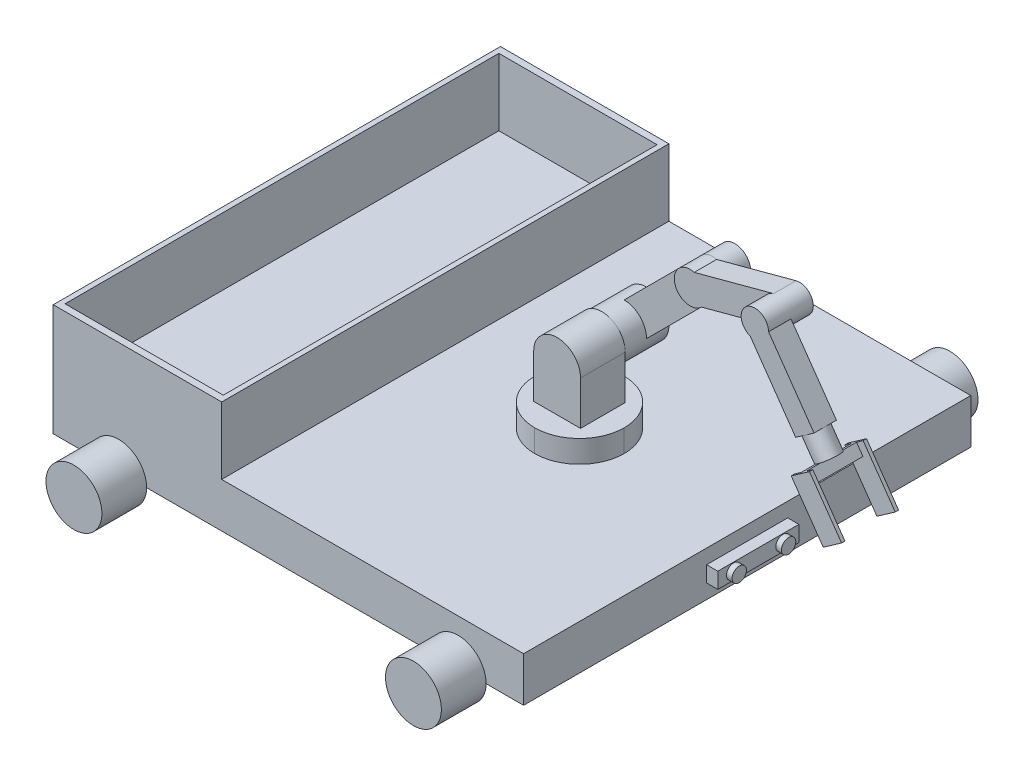
from build123d import *

# Parameters (mm, degrees)
SKETCH1_W                 = 60
SKETCH1_H                 = 4
BOSS_EXTRUDE1_DEPTH       = 40
SKETCH2_R                 = 2.5
BOSS_EXTRUDE2_DEPTH       = 4
BOSS_EXTRUDE3_START       = -44
SKETCH3_R                 = 2.5
BOSS_EXTRUDE3_DEPTH       = 4
BOSS_EXTRUDE4_DEPTH       = 4
BOSS_EXTRUDE4_DEPTH_BACK  = 4
BOSS_EXTRUDE4_START       = -20
FILLET1_R                 = 4
SKETCH5_W                 = 4.188069512
SKETCH5_H                 = 4
BOSS_EXTRUDE5_DEPTH       = 6
FILLET2_RADIUS            = 2.094034756
FILLET2_LENGTH            = 4
SKETCH6_R                 = 2
BOSS_EXTRUDE6_DEPTH       = 2
BOSS_EXTRUDE7_DEPTH       = 2
FILLET3_R                 = 1.415614
BOSS_EXTRUDE8_DEPTH       = 2
FILLET5_RADIUS            = 1.225957443
FILLET5_LENGTH            = 2
BOSS_EXTRUDE9_DEPTH       = 2
SKETCH10_R                = 1
BOSS_EXTRUDE10_DEPTH      = 2
SKETCH11_W                = 0.54512003
SKETCH11_H                = 4.5
BOSS_EXTRUDE11_DEPTH      = 1
BOSS_EXTRUDE12_DEPTH      = 4
BOSS_EXTRUDE12_DEPTH_BACK = 1
SKETCH12_W                = 2
SKETCH12_H                = 0.3
CUT_EXTRUDE1_DEPTH        = 14
CUT_EXTRUDE1_DEPTH_BACK   = 49
SKETCH15_R                = 2.5
BOSS_EXTRUDE13_DEPTH      = 4
BOSS_EXTRUDE14_START      = 4
SKETCH16_R                = 2.5
BOSS_EXTRUDE14_DEPTH      = 4
SKETCH17_W                = 15.06704388
SKETCH17_H                = 40
SKETCH17_W_2              = 14.155070378
SKETCH17_H_2              = 38.805630358
BOSS_EXTRUDE15_DEPTH      = 6
SKETCH18_W                = 7.25313331
SKETCH18_H                = 1.413138482
BOSS_EXTRUDE16_DEPTH      = 1
SKETCH19_R                = 0.644072862
BOSS_EXTRUDE17_DEPTH      = 0.5
BOSS_EXTRUDE18_DEPTH      = 0.5


with BuildPart() as part:
    # Sketch1 → Boss-Extrude1 (new body)
    with BuildSketch(Plane.XY):
        with Locations((30, 2)):
            Rectangle(SKETCH1_W, SKETCH1_H)
    extrude(amount=BOSS_EXTRUDE1_DEPTH)

    # Sketch2 → Boss-Extrude2 (add)
    with BuildSketch(Plane.XY.offset(40)):
        with Locations((5.851885616, 0)):
            Circle(SKETCH2_R)
        with Locations((54.148114384, 0)):
            Circle(SKETCH2_R)
    extrude(amount=BOSS_EXTRUDE2_DEPTH)

    # Sketch3 → Boss-Extrude3 (add)
    with BuildSketch(Plane.XY.offset(40).offset(BOSS_EXTRUDE3_START)):
        with Locations((54.148114384, 0)):
            Circle(SKETCH3_R)
        with Locations((5.851885616, 0)):
            Circle(SKETCH3_R)
    extrude(amount=BOSS_EXTRUDE3_DEPTH)

    # Sketch4 → Boss-Extrude4 (add, two sides: drawn at the far end of the back side and taken through both)
    with BuildSketch(Plane(origin=(0, 0, 0), x_dir=(-1, 0, 0), z_dir=(0, 0, -1)).offset(BOSS_EXTRUDE4_START - BOSS_EXTRUDE4_DEPTH_BACK)):
        Polygon((-45, 6), (-41, 6), (-41, 4), (-49, 4), (-49, 6), align=None)
    extrude(amount=BOSS_EXTRUDE4_DEPTH + BOSS_EXTRUDE4_DEPTH_BACK)

    # Fillet1
    fillet1_edges = [part.edges().sort_by_distance(p)[0] for p in [
        (49, 5, 24),
        (41, 5, 24),
        (41, 5, 16),
        (49, 5, 16),
    ]]
    fillet(fillet1_edges, radius=FILLET1_R - 0.0001)  # a hair under: the kernel refuses the full size

    # Sketch5 → Boss-Extrude5 (add)
    with BuildSketch(Plane(origin=(0, 6, 0), x_dir=(1, 0, 0), z_dir=(0, 1, 0))):
        with Locations((45, -20)):
            Rectangle(SKETCH5_W, SKETCH5_H)
    extrude(amount=BOSS_EXTRUDE5_DEPTH)

    # Fillet2: full round fillet: the end face becomes a half cylinder, R = half its width
    fillet2_face = Plane((45, 12, 20), x_dir=(0, 0, -1), z_dir=(0, 1, 0))  # on the end face: x along it, z out of the body
    fillet2_slab = fillet2_face.offset(-FILLET2_RADIUS / 2) * Box(FILLET2_LENGTH, 2 * FILLET2_RADIUS, FILLET2_RADIUS, mode=Mode.PRIVATE)  # the body's end, R deep
    fillet2_round = Plane((45, 9.905965244, 20), x_dir=(0, 1, 0), z_dir=(0, 0, -1)) * Cylinder(FILLET2_RADIUS, FILLET2_LENGTH, mode=Mode.PRIVATE)  # its axis R under the face
    add(fillet2_slab - fillet2_round, mode=Mode.SUBTRACT)

    # Sketch6 → Boss-Extrude6 (add)
    with BuildSketch(Plane(origin=(0, 0, 18), x_dir=(-1, 0, 0), z_dir=(0, 0, -1))):
        with Locations(Location((-45, 9.905965244, 0), (0, 0, 180))):
            Circle(SKETCH6_R)
    extrude(amount=BOSS_EXTRUDE6_DEPTH)

    # Sketch7 → Boss-Extrude7 (add)
    with BuildSketch(Plane(origin=(0, 0, 16), x_dir=(-1, 0, 0), z_dir=(0, 0, -1))):
        with BuildLine():
            Line((-47, 9.905965244), (-54.899494937, 17.80546018))
            Line((-54.899494937, 17.80546018), (-52.897227436, 19.807727681))
            Line((-52.897227436, 19.807727681), (-45, 11.905965244))
            ThreePointArc((-45, 11.905965244), (-43.585786438, 8.491751681), (-47, 9.905965244))
        make_face()
    extrude(amount=BOSS_EXTRUDE7_DEPTH)

    # Fillet3
    fillet3_edges = [part.edges().sort_by_distance(p)[0] for p in [
        (52.897227436, 19.807727681, 15),
        (54.899494937, 17.80546018, 15),
    ]]
    fillet(fillet3_edges, radius=FILLET3_R - 0.0001)  # a hair under: the kernel refuses the full size

    # Sketch8 → Boss-Extrude8 (add)
    with BuildSketch(Plane.XY.offset(16)):
        with BuildLine():
            Line((53.898504871, 16.804470115), (62.190066334, 19.027462822))
            Line((62.190066334, 19.027462822), (61.555124158, 21.39573963))
            Line((61.555124158, 21.39573963), (53.263562674, 19.172746917))
            ThreePointArc((53.263562674, 19.172746917), (51.53004592, 17.43873245), (53.898504871, 16.804470115))
        make_face()
    extrude(amount=BOSS_EXTRUDE8_DEPTH)

    # Fillet5: full round fillet: the end face becomes a half cylinder, R = half its width
    fillet5_face = Plane((61.872595246, 20.211601226, 17), x_dir=(0, 0, -1), z_dir=(0.965888670152, 0.258957673901, 0))  # on the end face: x along it, z out of the body
    fillet5_slab = fillet5_face.offset(-FILLET5_RADIUS / 2) * Box(FILLET5_LENGTH, 2 * FILLET5_RADIUS, FILLET5_RADIUS, mode=Mode.PRIVATE)  # the body's end, R deep
    fillet5_round = Plane((60.688456842, 19.894130138, 17), x_dir=(0.965888670152, 0.258957673901, 0), z_dir=(0, 0, -1)) * Cylinder(FILLET5_RADIUS, FILLET5_LENGTH, mode=Mode.PRIVATE)  # its axis R under the face
    add(fillet5_slab - fillet5_round, mode=Mode.SUBTRACT)

    # Sketch9 → Boss-Extrude9 (add)
    with BuildSketch(Plane.XY.offset(18)):
        with BuildLine():
            Line((61.914414285, 19.894130138), (65.983158691, 14.083360924))
            Line((65.983158691, 14.083360924), (64.337899108, 12.931337762))
            Line((64.337899108, 12.931337762), (60.269154702, 18.742106976))
            ThreePointArc((60.269154702, 18.742106976), (59.985276541, 20.898375684), (61.914414285, 19.894130138))
        make_face()
    extrude(amount=BOSS_EXTRUDE9_DEPTH)

    # Sketch10 → Boss-Extrude10 (add)
    with BuildSketch(Plane(origin=(15.090779481, -21.551866636, 0), x_dir=(-0.819152044288994, -0.5735764363510429, 0), z_dir=(0.5735764363510429, -0.819152044288994, 0))):
        with Locations(Location((-61.123877756, -19, 0), (0, 0, 90))):
            Circle(SKETCH10_R)
    extrude(amount=BOSS_EXTRUDE10_DEPTH)

    # Sketch11 → Boss-Extrude11 (add)
    with BuildSketch(Plane(origin=(16.237932354, -23.190170725, 0), x_dir=(0.819152044288994, 0.5735764363510429, 0), z_dir=(0.5735764363510429, -0.819152044288994, 0))):
        with Locations((61.123877756, 19)):
            Rectangle(SKETCH11_W, SKETCH11_H)
    extrude(amount=BOSS_EXTRUDE11_DEPTH)

    # Sketch12 → Boss-Extrude12 (add, two sides: drawn at the far end of the back side and taken through both)
    with BuildSketch(Plane(origin=(16.81150879, -24.009322769, 0), x_dir=(0.8191520442889951, 0.5735764363510415, 0), z_dir=(0.5735764363510415, -0.8191520442889951, 0)).offset(-BOSS_EXTRUDE12_DEPTH_BACK)):
        with Locations((61.123877756, 21.4)):
            Rectangle(SKETCH12_W, SKETCH12_H)
        with Locations((61.123877756, 16.6)):
            Rectangle(SKETCH12_W, SKETCH12_H)
    extrude(amount=BOSS_EXTRUDE12_DEPTH + BOSS_EXTRUDE12_DEPTH_BACK)

    # Sketch14 → Cut-Extrude1 (cut, two sides: drawn at the far end of the back side and taken through both)
    with BuildSketch(Plane(origin=(0, 0, 0), x_dir=(-1, 0, 0), z_dir=(0, 0, -1)).offset(-CUT_EXTRUDE1_DEPTH_BACK)):
        Polygon((-17.930145762, 4), (-17.930145762, 0), (-15.613292473, -10.944459553), (7.528960774, -7.975264797), (13.205362514, 7.656672302), (12.296445689, 9.602073226), (4.996412305, 18.310841722), align=None)
    extrude(amount=CUT_EXTRUDE1_DEPTH + CUT_EXTRUDE1_DEPTH_BACK, mode=Mode.SUBTRACT)

    # Sketch15 → Boss-Extrude13 (add)
    with BuildSketch(Plane(origin=(0, 0, 0), x_dir=(-1, 0, 0), z_dir=(0, 0, -1))):
        with Locations(Location((-23.782031378, 0, 0), (0, 0, 180))):
            Circle(SKETCH15_R)
    extrude(amount=BOSS_EXTRUDE13_DEPTH)

    # Sketch16 → Boss-Extrude14 (add)
    with BuildSketch(Plane.XY.offset(40).offset(BOSS_EXTRUDE14_START)):
        with Locations((23.782031378, 0)):
            Circle(SKETCH16_R)
    extrude(amount=-BOSS_EXTRUDE14_DEPTH)

    # Sketch17 → Boss-Extrude15 (add)
    with BuildSketch(Plane(origin=(0, 4, 0), x_dir=(1, 0, 0), z_dir=(0, 1, 0))):
        with Locations((25.463667702, -20)):
            Rectangle(SKETCH17_W, SKETCH17_H)
        with Locations((25.463667702, -20)):
            Rectangle(SKETCH17_W_2, SKETCH17_H_2, mode=Mode.SUBTRACT)
    extrude(amount=BOSS_EXTRUDE15_DEPTH)

    # Sketch18 → Boss-Extrude16 (add)
    with BuildSketch(Plane(origin=(60, 0, 0), x_dir=(0, 0, -1), z_dir=(1, 0, 0))):
        with Locations((-20, 2)):
            Rectangle(SKETCH18_W, SKETCH18_H)
    extrude(amount=BOSS_EXTRUDE16_DEPTH)

    # Sketch19 → Boss-Extrude17 (add)
    with BuildSketch(Plane(origin=(61, 0, 0), x_dir=(0, 0, -1), z_dir=(1, 0, 0))):
        with Locations((-22.206612517, 2)):
            Circle(SKETCH19_R)
        with Locations(Location((-17.793387483, 2, 0), (0, 0, 180))):
            Circle(SKETCH19_R)
    extrude(amount=BOSS_EXTRUDE17_DEPTH)

    # Sketch20 → Boss-Extrude18 (add)
    # profile 1 of 11: a face of its own
    with BuildSketch(Plane(origin=(0, 0, 0), x_dir=(-1, 0, 0), z_dir=(0, 0, -1))):
        Polygon((-29.740230985, 7.915289457), (-29.621507695, 7.915289457), (-29.621507695, 7.372554415), (-28.943088891, 7.372554415), (-28.943088891, 7.915289457), (-28.824365601, 7.915289457), (-28.824365601, 6.592372791), (-28.943088891, 6.592372791), (-28.943088891, 7.236870654), (-29.621507695, 7.236870654), (-29.621507695, 6.592372791), (-29.740230985, 6.592372791), align=None)
    # profile 2 of 11: a face of its own
    with BuildSketch(Plane(origin=(0, 0, 0), x_dir=(-1, 0, 0), z_dir=(0, 0, -1))):
        with BuildLine():
            add(Edge.make_bspline(
                [(-28.391873613, 6.795898432), (-28.384506777, 6.795460672), (-28.370064956, 6.794602496), (-28.349185881, 6.788714884), (-28.33028909, 6.778260569), (-28.313456962, 6.764327317), (-28.299582788, 6.74743342), (-28.288755904, 6.728687347), (-28.28291958, 6.707633472), (-28.282067655, 6.693107969), (-28.281630558, 6.685655376)],
                knots=[0, 0, 0, 0, 1.020151414, 1.999887582, 2.974338812, 3.990962822, 5.007586832, 5.987933904, 6.967670073, 8, 8, 8, 8], degree=3))
            add(Edge.make_bspline(
                [(-28.281630558, 6.685655376), (-28.282082467, 6.678381856), (-28.282973624, 6.66403858), (-28.288742526, 6.643143503), (-28.299665301, 6.624385715), (-28.313361266, 6.607262585), (-28.330293251, 6.593299816), (-28.349230556, 6.582934445), (-28.370015942, 6.576625274), (-28.3844986, 6.575821584), (-28.391873613, 6.57541232)],
                knots=[0, 0, 0, 0, 1.009421747, 1.99056486, 2.972319754, 3.999869655, 5.017953583, 5.993804169, 6.978383603, 8, 8, 8, 8], degree=3))
            add(Edge.make_bspline(
                [(-28.391873613, 6.57541232), (-28.399253941, 6.575806775), (-28.413662273, 6.576576855), (-28.434370075, 6.583063987), (-28.453422709, 6.593202616), (-28.470351397, 6.607288621), (-28.48416207, 6.624297603), (-28.494603807, 6.643272687), (-28.500874488, 6.663978766), (-28.501699184, 6.678370075), (-28.502116669, 6.685655376)],
                knots=[0, 0, 0, 0, 1.022052826, 1.995314843, 2.982371812, 4.00089066, 5.028879526, 6.005146991, 6.990147033, 8, 8, 8, 8], degree=3))
            add(Edge.make_bspline(
                [(-28.502116669, 6.685655376), (-28.501715221, 6.693120171), (-28.500931442, 6.707694268), (-28.494590642, 6.728558216), (-28.484243086, 6.747520692), (-28.470255928, 6.764301542), (-28.453426804, 6.778357457), (-28.434416036, 6.788587305), (-28.4136124, 6.794650198), (-28.399245548, 6.795475138), (-28.391873613, 6.795898432)],
                knots=[0, 0, 0, 0, 1.032775665, 2.016367738, 2.991239715, 4.008302682, 5.025365648, 6.011011707, 6.979408107, 8, 8, 8, 8], degree=3))
        make_face()
    # profile 3 of 11: a face of its own
    with BuildSketch(Plane(origin=(0, 0, 0), x_dir=(-1, 0, 0), z_dir=(0, 0, -1))):
        Polygon((-27.450567524, 7.915289457), (-26.839990601, 6.592372791), (-26.969049178, 6.592372791), (-27.164624598, 7.016384543), (-27.76433622, 7.016384543), (-27.965476795, 6.592372791), (-28.095065387, 6.592372791), (-27.467527994, 7.915289457), align=None)
        Polygon((-27.460372796, 7.65743731), (-27.699939435, 7.152068303), (-27.227166332, 7.152068303), align=None, mode=Mode.SUBTRACT)
    # profile 4 of 11: a face of its own
    with BuildSketch(Plane(origin=(0, 0, 0), x_dir=(-1, 0, 0), z_dir=(0, 0, -1))):
        with BuildLine():
            add(Edge.make_bspline(
                [(-26.509261434, 6.795898432), (-26.501894598, 6.795460672), (-26.487452777, 6.794602496), (-26.466573702, 6.788714884), (-26.447676911, 6.778260569), (-26.430844782, 6.764327317), (-26.416970608, 6.74743342), (-26.406143725, 6.728687347), (-26.4003074, 6.707633472), (-26.399455475, 6.693107969), (-26.399018378, 6.685655376)],
                knots=[0, 0, 0, 0, 1.020151414, 1.999887582, 2.974338812, 3.990962822, 5.007586832, 5.987933904, 6.967670073, 8, 8, 8, 8], degree=3))
            add(Edge.make_bspline(
                [(-26.399018378, 6.685655376), (-26.399470287, 6.678381856), (-26.400361444, 6.66403858), (-26.406130347, 6.643143503), (-26.417053122, 6.624385715), (-26.430749086, 6.607262585), (-26.447681072, 6.593299816), (-26.466618377, 6.582934445), (-26.487403763, 6.576625274), (-26.501886421, 6.575821584), (-26.509261434, 6.57541232)],
                knots=[0, 0, 0, 0, 1.009421747, 1.99056486, 2.972319754, 3.999869655, 5.017953583, 5.993804169, 6.978383603, 8, 8, 8, 8], degree=3))
            add(Edge.make_bspline(
                [(-26.509261434, 6.57541232), (-26.516641761, 6.575806775), (-26.531050094, 6.576576855), (-26.551757895, 6.583063987), (-26.570810529, 6.593202616), (-26.587739218, 6.607288621), (-26.60154989, 6.624297603), (-26.611991627, 6.643272687), (-26.618262308, 6.663978766), (-26.619087004, 6.678370075), (-26.61950449, 6.685655376)],
                knots=[0, 0, 0, 0, 1.022052826, 1.995314843, 2.982371812, 4.00089066, 5.028879526, 6.005146991, 6.990147033, 8, 8, 8, 8], degree=3))
            add(Edge.make_bspline(
                [(-26.61950449, 6.685655376), (-26.619103041, 6.693120171), (-26.618319263, 6.707694268), (-26.611978463, 6.728558216), (-26.601630906, 6.747520692), (-26.587643748, 6.764301542), (-26.570814625, 6.778357457), (-26.551803856, 6.788587305), (-26.531000221, 6.794650198), (-26.516633369, 6.795475138), (-26.509261434, 6.795898432)],
                knots=[0, 0, 0, 0, 1.032775665, 2.016367738, 2.991239715, 4.008302682, 5.025365648, 6.011011707, 6.979408107, 8, 8, 8, 8], degree=3))
        make_face()
    # profile 5 of 11: a face of its own
    with BuildSketch(Plane(origin=(0, 0, 0), x_dir=(-1, 0, 0), z_dir=(0, 0, -1))):
        with BuildLine():
            Line((-26.110690387, 7.915289457), (-25.845948049, 7.915289457))
            add(Edge.make_bspline(
                [(-25.845948049, 7.915289457), (-25.828281016, 7.915230649), (-25.794358354, 7.915117732), (-25.745760719, 7.914488113), (-25.701602858, 7.91268352), (-25.661907859, 7.911130574), (-25.626676451, 7.908298798), (-25.5958006, 7.905592244), (-25.569422512, 7.902049224), (-25.553454586, 7.898758781), (-25.546224742, 7.897268958)],
                knots=[0, 0, 0, 0, 1.410062039, 2.707475311, 3.878576406, 4.937260626, 5.877586885, 6.699081471, 7.410979367, 8, 8, 8, 8], degree=3))
            add(Edge.make_bspline(
                [(-25.546224742, 7.897268958), (-25.536546048, 7.894877591), (-25.517395132, 7.890145872), (-25.489821744, 7.880144773), (-25.463546985, 7.868571284), (-25.438679997, 7.854977854), (-25.415345338, 7.839263577), (-25.393302405, 7.821699733), (-25.372451174, 7.802382426), (-25.353634903, 7.780824614), (-25.335893059, 7.758207838), (-25.320929501, 7.733751359), (-25.308030504, 7.708176912), (-25.297760695, 7.681224406), (-25.289491342, 7.653155224), (-25.283660591, 7.623715114), (-25.280163862, 7.593038198), (-25.279807863, 7.572114226), (-25.279627353, 7.561504652)],
                knots=[0, 0, 0, 0, 1.027469482, 2.033020251, 3.019912614, 3.986113645, 4.951240523, 5.91722682, 6.890402269, 7.87763091, 8.8651537, 9.85103654, 10.82876324, 11.815024772, 12.821070561, 13.842952187, 14.906261191, 16, 16, 16, 16], degree=3))
            add(Edge.make_bspline(
                [(-25.279627353, 7.561504652), (-25.280182599, 7.543877692), (-25.281266028, 7.50948293), (-25.291367481, 7.459567061), (-25.307913964, 7.413004433), (-25.33071473, 7.369853674), (-25.359750663, 7.3309559), (-25.394647236, 7.29679046), (-25.435423917, 7.268200374), (-25.473383807, 7.248374463), (-25.506915662, 7.235677143), (-25.534520515, 7.226743162), (-25.564632736, 7.219840574), (-25.596963812, 7.213656834), (-25.631648289, 7.208988188), (-25.668603036, 7.20556879), (-25.707854409, 7.203431694), (-25.734818878, 7.203113437), (-25.748690354, 7.202949714)],
                knots=[0, 0, 0, 0, 1.260483769, 2.459530307, 3.627416485, 4.787058657, 5.939039949, 7.08810263, 8.267026773, 9.491475466, 10.141966685, 10.831826277, 11.566392101, 12.351337768, 13.187381173, 14.07005841, 15.007169909, 16, 16, 16, 16], degree=3))
            Line((-25.748690354, 7.202949714), (-25.262666883, 6.592372791))
            Line((-25.262666883, 6.592372791), (-25.409480952, 6.592372791))
            Line((-25.409480952, 6.592372791), (-25.895504423, 7.202949714))
            Line((-25.895504423, 7.202949714), (-25.991967096, 7.202949714))
            Line((-25.991967096, 7.202949714), (-25.991967096, 6.592372791))
            Line((-25.991967096, 6.592372791), (-26.110690387, 6.592372791))
            Line((-26.110690387, 6.592372791), (-26.110690387, 7.915289457))
        make_face()
        with BuildLine():
            Line((-25.991967096, 7.779605697), (-25.991967096, 7.338633474))
            Line((-25.991967096, 7.338633474), (-25.749750383, 7.336778423))
            add(Edge.make_bspline(
                [(-25.749750383, 7.336778423), (-25.738441321, 7.33677342), (-25.716521137, 7.336763722), (-25.684808683, 7.338273275), (-25.655281141, 7.339990541), (-25.628051452, 7.342617228), (-25.603107452, 7.34600241), (-25.580461608, 7.350236871), (-25.560076954, 7.35517024), (-25.536302805, 7.362805974), (-25.509755068, 7.374903486), (-25.480903594, 7.392504136), (-25.456334258, 7.414641869), (-25.435576613, 7.439956241), (-25.418896739, 7.467788989), (-25.407137123, 7.497806486), (-25.39967495, 7.529250929), (-25.398794815, 7.550862893), (-25.398350643, 7.561769659)],
                knots=[0, 0, 0, 0, 1.146690395, 2.22261258, 3.21895312, 4.145990853, 4.996080663, 5.770904154, 6.481378293, 7.121626537, 8.300444488, 9.431385265, 10.535395872, 11.636531494, 12.74115979, 13.810798291, 14.895190096, 16, 16, 16, 16], degree=3))
            add(Edge.make_bspline(
                [(-25.398350643, 7.561769659), (-25.398805017, 7.572408394), (-25.399705418, 7.593490484), (-25.40705659, 7.624354474), (-25.419487993, 7.653483946), (-25.436240743, 7.680760403), (-25.456651138, 7.705520012), (-25.480583764, 7.726704501), (-25.50738424, 7.744185697), (-25.532433175, 7.75535655), (-25.554822297, 7.762205423), (-25.574261484, 7.767025059), (-25.596226239, 7.770897224), (-25.620823213, 7.773999676), (-25.6479474, 7.776666277), (-25.67773595, 7.778462336), (-25.709991221, 7.77952591), (-25.732347353, 7.779578482), (-25.743920221, 7.779605697)],
                knots=[0, 0, 0, 0, 1.101028733, 2.181837193, 3.264309656, 4.369019818, 5.486613113, 6.575447106, 7.666700264, 8.788928104, 9.402425223, 10.0903467, 10.862060571, 11.710948788, 12.657782767, 13.684531032, 14.801375019, 16, 16, 16, 16], degree=3))
            Line((-25.743920221, 7.779605697), (-25.991967096, 7.779605697))
        make_face(mode=Mode.SUBTRACT)
    # profile 6 of 11: a face of its own
    with BuildSketch(Plane(origin=(0, 0, 0), x_dir=(-1, 0, 0), z_dir=(0, 0, -1))):
        with BuildLine():
            add(Edge.make_bspline(
                [(-24.898016776, 6.795898432), (-24.89064994, 6.795460672), (-24.876208119, 6.794602496), (-24.855329043, 6.788714884), (-24.836432252, 6.778260569), (-24.819600124, 6.764327317), (-24.80572595, 6.74743342), (-24.794899067, 6.728687347), (-24.789062742, 6.707633472), (-24.788210817, 6.693107969), (-24.78777372, 6.685655376)],
                knots=[0, 0, 0, 0, 1.020151414, 1.999887582, 2.974338812, 3.990962822, 5.007586832, 5.987933904, 6.967670073, 8, 8, 8, 8], degree=3))
            add(Edge.make_bspline(
                [(-24.78777372, 6.685655376), (-24.788225629, 6.678381856), (-24.789116786, 6.66403858), (-24.794885689, 6.643143503), (-24.805808463, 6.624385715), (-24.819504428, 6.607262585), (-24.836436413, 6.593299816), (-24.855373718, 6.582934445), (-24.876159105, 6.576625274), (-24.890641763, 6.575821584), (-24.898016776, 6.57541232)],
                knots=[0, 0, 0, 0, 1.009421747, 1.99056486, 2.972319754, 3.999869655, 5.017953583, 5.993804169, 6.978383603, 8, 8, 8, 8], degree=3))
            add(Edge.make_bspline(
                [(-24.898016776, 6.57541232), (-24.905397103, 6.575806775), (-24.919805436, 6.576576855), (-24.940513237, 6.583063987), (-24.959565871, 6.593202616), (-24.97649456, 6.607288621), (-24.990305232, 6.624297603), (-25.000746969, 6.643272687), (-25.00701765, 6.663978766), (-25.007842346, 6.678370075), (-25.008259831, 6.685655376)],
                knots=[0, 0, 0, 0, 1.022052826, 1.995314843, 2.982371812, 4.00089066, 5.028879526, 6.005146991, 6.990147033, 8, 8, 8, 8], degree=3))
            add(Edge.make_bspline(
                [(-25.008259831, 6.685655376), (-25.007858383, 6.693120171), (-25.007074605, 6.707694268), (-25.000733805, 6.728558216), (-24.990386248, 6.747520692), (-24.97639909, 6.764301542), (-24.959569966, 6.778357457), (-24.940559198, 6.788587305), (-24.919755563, 6.794650198), (-24.905388711, 6.795475138), (-24.898016776, 6.795898432)],
                knots=[0, 0, 0, 0, 1.032775665, 2.016367738, 2.991239715, 4.008302682, 5.025365648, 6.011011707, 6.979408107, 8, 8, 8, 8], degree=3))
        make_face()
    # profile 7 of 11: a face of its own
    with BuildSketch(Plane(origin=(0, 0, 0), x_dir=(-1, 0, 0), z_dir=(0, 0, -1))):
        with BuildLine():
            Line((-24.499445729, 7.915289457), (-24.240003538, 7.915289457))
            add(Edge.make_bspline(
                [(-24.240003538, 7.915289457), (-24.22215894, 7.915269842), (-24.187967896, 7.915232257), (-24.138938694, 7.914092755), (-24.09440942, 7.912570762), (-24.054476092, 7.910460939), (-24.01901584, 7.907967585), (-23.988189123, 7.904470534), (-23.961753636, 7.900819172), (-23.945913996, 7.897106915), (-23.938690187, 7.895413906)],
                knots=[0, 0, 0, 0, 1.415646017, 2.712440637, 3.8905458, 4.950247383, 5.884950622, 6.709939814, 7.411656543, 8, 8, 8, 8], degree=3))
            add(Edge.make_bspline(
                [(-23.938690187, 7.895413906), (-23.929545607, 7.892910967), (-23.911471928, 7.887964067), (-23.885428974, 7.878055904), (-23.860651181, 7.866307585), (-23.837053539, 7.852918179), (-23.814926025, 7.837313219), (-23.793938504, 7.820125274), (-23.77427619, 7.800957509), (-23.756049652, 7.780024908), (-23.739311053, 7.757678876), (-23.724898941, 7.733585831), (-23.712831209, 7.70815132), (-23.702480984, 7.681393036), (-23.695031658, 7.653086277), (-23.689419883, 7.623427728), (-23.685857976, 7.592420568), (-23.685516829, 7.571231273), (-23.685343165, 7.560444622)],
                knots=[0, 0, 0, 0, 0.999701418, 1.975846123, 2.934577507, 3.890451536, 4.834027766, 5.787354733, 6.749476667, 7.726910423, 8.712836071, 9.690891519, 10.682875813, 11.679750201, 12.712814741, 13.765529915, 14.8625177, 16, 16, 16, 16], degree=3))
            add(Edge.make_bspline(
                [(-23.685343165, 7.560444622), (-23.685502453, 7.549567308), (-23.685814112, 7.528285107), (-23.689554672, 7.497150155), (-23.694593167, 7.467396477), (-23.702340565, 7.439090048), (-23.71248759, 7.412398968), (-23.724390836, 7.386915348), (-23.738747707, 7.363072734), (-23.755244413, 7.340784567), (-23.77359576, 7.320029928), (-23.793724102, 7.300959217), (-23.81554818, 7.283684065), (-23.838998635, 7.268165745), (-23.864304084, 7.254764115), (-23.891080731, 7.24276061), (-23.919561319, 7.232679584), (-23.939269948, 7.227376555), (-23.94929048, 7.224680316)],
                knots=[0, 0, 0, 0, 1.121902311, 2.195077645, 3.232258892, 4.234102512, 5.217864754, 6.176164875, 7.132989551, 8.084763148, 9.034132444, 9.988522005, 10.94243251, 11.903244335, 12.886203696, 13.894208494, 14.929344452, 16, 16, 16, 16], degree=3))
            add(Edge.make_bspline(
                [(-23.94929048, 7.224680316), (-23.957578491, 7.22291782), (-23.975742147, 7.219055208), (-24.005656211, 7.214743083), (-24.040484973, 7.211062502), (-24.080180895, 7.208302846), (-24.124708344, 7.205940355), (-24.174091408, 7.204062534), (-24.228427027, 7.203030714), (-24.26632717, 7.202977498), (-24.286114816, 7.202949714)],
                knots=[0, 0, 0, 0, 0.601384939, 1.31797006, 2.144135048, 3.087295005, 4.142315834, 5.309527816, 6.595305764, 8, 8, 8, 8], degree=3))
            Line((-24.286114816, 7.202949714), (-24.380722438, 7.202949714))
            Line((-24.380722438, 7.202949714), (-24.380722438, 6.592372791))
            Line((-24.380722438, 6.592372791), (-24.499445729, 6.592372791))
            Line((-24.499445729, 6.592372791), (-24.499445729, 7.915289457))
        make_face()
        with BuildLine():
            Line((-24.380722438, 7.779605697), (-24.380722438, 7.338633474))
            Line((-24.380722438, 7.338633474), (-24.149106019, 7.335718394))
            add(Edge.make_bspline(
                [(-24.149106019, 7.335718394), (-24.137796999, 7.335712549), (-24.11596517, 7.335701265), (-24.084428264, 7.337207585), (-24.055169397, 7.338946477), (-24.028278441, 7.341492495), (-24.003743275, 7.345091304), (-23.981522989, 7.348724312), (-23.961789879, 7.353980208), (-23.938695836, 7.361057082), (-23.912961951, 7.373126851), (-23.884966182, 7.390646006), (-23.861240394, 7.412977107), (-23.840709372, 7.438085245), (-23.824416376, 7.466017357), (-23.812488962, 7.495903532), (-23.805480846, 7.527437273), (-23.804541124, 7.54901523), (-23.804066455, 7.559914607)],
                knots=[0, 0, 0, 0, 1.160613943, 2.240541288, 3.23993089, 4.169200891, 5.011653406, 5.7853311, 6.478053781, 7.106038997, 8.262395093, 9.384106736, 10.481365981, 11.59014053, 12.70357646, 13.786202915, 14.881775077, 16, 16, 16, 16], degree=3))
            add(Edge.make_bspline(
                [(-23.804066455, 7.559914607), (-23.804543706, 7.570550296), (-23.80549242, 7.591692727), (-23.812543892, 7.622678747), (-23.824393187, 7.65224998), (-23.840818745, 7.679832069), (-23.860753636, 7.704849861), (-23.883923328, 7.726582406), (-23.910273281, 7.744053109), (-23.934784368, 7.755329379), (-23.956556245, 7.76221432), (-23.975467135, 7.767031566), (-23.996819265, 7.770877703), (-24.020619586, 7.773992039), (-24.046683628, 7.776658079), (-24.075235312, 7.778467065), (-24.106166481, 7.779525949), (-24.127639524, 7.77957847), (-24.138770732, 7.779605697)],
                knots=[0, 0, 0, 0, 1.120700087, 2.227813068, 3.331159281, 4.466773991, 5.599788987, 6.693661531, 7.80175334, 8.91857717, 9.525282508, 10.207424825, 10.974604443, 11.810962634, 12.737642355, 13.736264703, 14.826523623, 16, 16, 16, 16], degree=3))
            Line((-24.138770732, 7.779605697), (-24.380722438, 7.779605697))
        make_face(mode=Mode.SUBTRACT)
    # profile 8 of 11: a face of its own
    with BuildSketch(Plane(origin=(0, 0, 0), x_dir=(-1, 0, 0), z_dir=(0, 0, -1))):
        with BuildLine():
            add(Edge.make_bspline(
                [(-23.320693058, 6.795898432), (-23.313326222, 6.795460672), (-23.298884401, 6.794602496), (-23.278005325, 6.788714884), (-23.259108534, 6.778260569), (-23.242276406, 6.764327317), (-23.228402232, 6.74743342), (-23.217575349, 6.728687347), (-23.211739024, 6.707633472), (-23.210887099, 6.693107969), (-23.210450002, 6.685655376)],
                knots=[0, 0, 0, 0, 1.020151414, 1.999887582, 2.974338812, 3.990962822, 5.007586832, 5.987933904, 6.967670073, 8, 8, 8, 8], degree=3))
            add(Edge.make_bspline(
                [(-23.210450002, 6.685655376), (-23.210901911, 6.678381856), (-23.211793068, 6.66403858), (-23.217561971, 6.643143503), (-23.228484746, 6.624385715), (-23.24218071, 6.607262585), (-23.259112695, 6.593299816), (-23.27805, 6.582934445), (-23.298835387, 6.576625274), (-23.313318045, 6.575821584), (-23.320693058, 6.57541232)],
                knots=[0, 0, 0, 0, 1.009421747, 1.99056486, 2.972319754, 3.999869655, 5.017953583, 5.993804169, 6.978383603, 8, 8, 8, 8], degree=3))
            add(Edge.make_bspline(
                [(-23.320693058, 6.57541232), (-23.328073385, 6.575806775), (-23.342481718, 6.576576855), (-23.363189519, 6.583063987), (-23.382242153, 6.593202616), (-23.399170842, 6.607288621), (-23.412981514, 6.624297603), (-23.423423251, 6.643272687), (-23.429693932, 6.663978766), (-23.430518628, 6.678370075), (-23.430936113, 6.685655376)],
                knots=[0, 0, 0, 0, 1.022052826, 1.995314843, 2.982371812, 4.00089066, 5.028879526, 6.005146991, 6.990147033, 8, 8, 8, 8], degree=3))
            add(Edge.make_bspline(
                [(-23.430936113, 6.685655376), (-23.430534665, 6.693120171), (-23.429750887, 6.707694268), (-23.423410087, 6.728558216), (-23.41306253, 6.747520692), (-23.399075372, 6.764301542), (-23.382246248, 6.778357457), (-23.36323548, 6.788587305), (-23.342431845, 6.794650198), (-23.328064993, 6.795475138), (-23.320693058, 6.795898432)],
                knots=[0, 0, 0, 0, 1.032775665, 2.016367738, 2.991239715, 4.008302682, 5.025365648, 6.011011707, 6.979408107, 8, 8, 8, 8], degree=3))
        make_face()
    # profile 9 of 11: a face of its own
    with BuildSketch(Plane(origin=(0, 0, 0), x_dir=(-1, 0, 0), z_dir=(0, 0, -1))):
        Polygon((-22.922122011, 7.915289457), (-22.175861327, 7.915289457), (-22.175861327, 7.779605697), (-22.80339872, 7.779605697), (-22.80339872, 7.372554415), (-22.175861327, 7.372554415), (-22.175861327, 7.236870654), (-22.80339872, 7.236870654), (-22.80339872, 6.728056551), (-22.175861327, 6.728056551), (-22.175861327, 6.592372791), (-22.922122011, 6.592372791), align=None)
    # profile 10 of 11: a face of its own
    with BuildSketch(Plane(origin=(0, 0, 0), x_dir=(-1, 0, 0), z_dir=(0, 0, -1))):
        with BuildLine():
            add(Edge.make_bspline(
                [(-21.84513216, 6.795898432), (-21.837765324, 6.795460672), (-21.823323503, 6.794602496), (-21.802444428, 6.788714884), (-21.783547637, 6.778260569), (-21.766715509, 6.764327317), (-21.752841335, 6.74743342), (-21.742014452, 6.728687347), (-21.736178127, 6.707633472), (-21.735326202, 6.693107969), (-21.734889105, 6.685655376)],
                knots=[0, 0, 0, 0, 1.020151414, 1.999887582, 2.974338812, 3.990962822, 5.007586832, 5.987933904, 6.967670073, 8, 8, 8, 8], degree=3))
            add(Edge.make_bspline(
                [(-21.734889105, 6.685655376), (-21.735341014, 6.678381856), (-21.736232171, 6.66403858), (-21.742001073, 6.643143503), (-21.752923848, 6.624385715), (-21.766619813, 6.607262585), (-21.783551798, 6.593299816), (-21.802489103, 6.582934445), (-21.823274489, 6.576625274), (-21.837757147, 6.575821584), (-21.84513216, 6.57541232)],
                knots=[0, 0, 0, 0, 1.009421747, 1.99056486, 2.972319754, 3.999869655, 5.017953583, 5.993804169, 6.978383603, 8, 8, 8, 8], degree=3))
            add(Edge.make_bspline(
                [(-21.84513216, 6.57541232), (-21.852512488, 6.575806775), (-21.86692082, 6.576576855), (-21.887628622, 6.583063987), (-21.906681256, 6.593202616), (-21.923609944, 6.607288621), (-21.937420617, 6.624297603), (-21.947862354, 6.643272687), (-21.954133035, 6.663978766), (-21.954957731, 6.678370075), (-21.955375216, 6.685655376)],
                knots=[0, 0, 0, 0, 1.022052826, 1.995314843, 2.982371812, 4.00089066, 5.028879526, 6.005146991, 6.990147033, 8, 8, 8, 8], degree=3))
            add(Edge.make_bspline(
                [(-21.955375216, 6.685655376), (-21.954973768, 6.693120171), (-21.954189989, 6.707694268), (-21.947849189, 6.728558216), (-21.937501633, 6.747520692), (-21.923514475, 6.764301542), (-21.906685351, 6.778357457), (-21.887674583, 6.788587305), (-21.866870947, 6.794650198), (-21.852504095, 6.795475138), (-21.84513216, 6.795898432)],
                knots=[0, 0, 0, 0, 1.032775665, 2.016367738, 2.991239715, 4.008302682, 5.025365648, 6.011011707, 6.979408107, 8, 8, 8, 8], degree=3))
        make_face()
    # profile 11 of 11: a face of its own
    with BuildSketch(Plane(origin=(0, 0, 0), x_dir=(-1, 0, 0), z_dir=(0, 0, -1))):
        with BuildLine():
            Line((-21.446561113, 7.915289457), (-21.181818776, 7.915289457))
            add(Edge.make_bspline(
                [(-21.181818776, 7.915289457), (-21.164151742, 7.915230649), (-21.13022908, 7.915117732), (-21.081631445, 7.914488113), (-21.037473584, 7.91268352), (-20.997778586, 7.911130574), (-20.962547177, 7.908298798), (-20.931671326, 7.905592244), (-20.905293238, 7.902049224), (-20.889325312, 7.898758781), (-20.882095468, 7.897268958)],
                knots=[0, 0, 0, 0, 1.410062039, 2.707475311, 3.878576406, 4.937260626, 5.877586885, 6.699081471, 7.410979367, 8, 8, 8, 8], degree=3))
            add(Edge.make_bspline(
                [(-20.882095468, 7.897268958), (-20.872416774, 7.894877591), (-20.853265859, 7.890145872), (-20.82569247, 7.880144773), (-20.799417711, 7.868571284), (-20.774550724, 7.854977854), (-20.751216065, 7.839263577), (-20.729173132, 7.821699733), (-20.7083219, 7.802382426), (-20.689505629, 7.780824614), (-20.671763785, 7.758207838), (-20.656800227, 7.733751359), (-20.64390123, 7.708176912), (-20.633631422, 7.681224406), (-20.625362069, 7.653155224), (-20.619531317, 7.623715114), (-20.616034589, 7.593038198), (-20.61567859, 7.572114226), (-20.615498079, 7.561504652)],
                knots=[0, 0, 0, 0, 1.027469482, 2.033020251, 3.019912614, 3.986113645, 4.951240523, 5.91722682, 6.890402269, 7.87763091, 8.8651537, 9.85103654, 10.82876324, 11.815024772, 12.821070561, 13.842952187, 14.906261191, 16, 16, 16, 16], degree=3))
            add(Edge.make_bspline(
                [(-20.615498079, 7.561504652), (-20.616053326, 7.543877692), (-20.617136755, 7.50948293), (-20.627238208, 7.459567061), (-20.64378469, 7.413004433), (-20.666585457, 7.369853674), (-20.69562139, 7.3309559), (-20.730517963, 7.29679046), (-20.771294643, 7.268200374), (-20.809254533, 7.248374463), (-20.842786389, 7.235677143), (-20.870391242, 7.226743162), (-20.900503463, 7.219840574), (-20.932834538, 7.213656834), (-20.967519015, 7.208988188), (-21.004473762, 7.20556879), (-21.043725135, 7.203431694), (-21.070689605, 7.203113437), (-21.08456108, 7.202949714)],
                knots=[0, 0, 0, 0, 1.260483769, 2.459530307, 3.627416485, 4.787058657, 5.939039949, 7.08810263, 8.267026773, 9.491475466, 10.141966685, 10.831826277, 11.566392101, 12.351337768, 13.187381173, 14.07005841, 15.007169909, 16, 16, 16, 16], degree=3))
            Line((-21.08456108, 7.202949714), (-20.598537609, 6.592372791))
            Line((-20.598537609, 6.592372791), (-20.745351678, 6.592372791))
            Line((-20.745351678, 6.592372791), (-21.231375149, 7.202949714))
            Line((-21.231375149, 7.202949714), (-21.327837823, 7.202949714))
            Line((-21.327837823, 7.202949714), (-21.327837823, 6.592372791))
            Line((-21.327837823, 6.592372791), (-21.446561113, 6.592372791))
            Line((-21.446561113, 6.592372791), (-21.446561113, 7.915289457))
        make_face()
        with BuildLine():
            Line((-21.327837823, 7.779605697), (-21.327837823, 7.338633474))
            Line((-21.327837823, 7.338633474), (-21.085621109, 7.336778423))
            add(Edge.make_bspline(
                [(-21.085621109, 7.336778423), (-21.074312047, 7.33677342), (-21.052391863, 7.336763722), (-21.02067941, 7.338273275), (-20.991151867, 7.339990541), (-20.963922178, 7.342617228), (-20.938978178, 7.34600241), (-20.916332335, 7.350236871), (-20.895947681, 7.35517024), (-20.872173531, 7.362805974), (-20.845625794, 7.374903486), (-20.81677432, 7.392504136), (-20.792204984, 7.414641869), (-20.77144734, 7.439956241), (-20.754767465, 7.467788989), (-20.74300785, 7.497806486), (-20.735545676, 7.529250929), (-20.734665542, 7.550862893), (-20.73422137, 7.561769659)],
                knots=[0, 0, 0, 0, 1.146690395, 2.22261258, 3.21895312, 4.145990853, 4.996080663, 5.770904154, 6.481378293, 7.121626537, 8.300444488, 9.431385265, 10.535395872, 11.636531494, 12.74115979, 13.810798291, 14.895190096, 16, 16, 16, 16], degree=3))
            add(Edge.make_bspline(
                [(-20.73422137, 7.561769659), (-20.734675743, 7.572408394), (-20.735576145, 7.593490484), (-20.742927316, 7.624354474), (-20.755358719, 7.653483946), (-20.77211147, 7.680760403), (-20.792521865, 7.705520012), (-20.81645449, 7.726704501), (-20.843254966, 7.744185697), (-20.868303901, 7.75535655), (-20.890693023, 7.762205423), (-20.91013221, 7.767025059), (-20.932096965, 7.770897224), (-20.956693939, 7.773999676), (-20.983818127, 7.776666277), (-21.013606676, 7.778462336), (-21.045861948, 7.77952591), (-21.068218079, 7.779578482), (-21.079790948, 7.779605697)],
                knots=[0, 0, 0, 0, 1.101028733, 2.181837193, 3.264309656, 4.369019818, 5.486613113, 6.575447106, 7.666700264, 8.788928104, 9.402425223, 10.0903467, 10.862060571, 11.710948788, 12.657782767, 13.684531032, 14.801375019, 16, 16, 16, 16], degree=3))
            Line((-21.079790948, 7.779605697), (-21.327837823, 7.779605697))
        make_face(mode=Mode.SUBTRACT)
    extrude(amount=BOSS_EXTRUDE18_DEPTH)


solid = part.part
